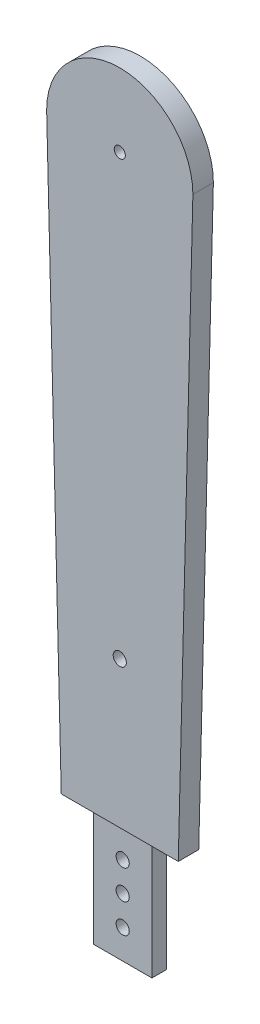
from build123d import *

# Parameters (mm, degrees)
BOSS_EXTRUDE3_DEPTH = 3.5
SKETCH18_R          = 2.25
CUT_EXTRUDE10_DEPTH = 14
SKETCH17_R          = 1.9
CUT_EXTRUDE13_DEPTH = 24
SKETCH14_W          = 20
SKETCH14_H          = 5
BOSS_EXTRUDE4_DEPTH = 40
SKETCH23_R          = 2.25
CUT_EXTRUDE15_DEPTH = 7


with BuildPart() as part:
    # Sketch7 → Boss-Extrude3 (new, symmetric)
    with BuildSketch(Plane.XY):
        with BuildLine():
            ThreePointArc((25, 0), (0, 25), (-25, 0))
            Line((-25, 0), (-20, -200))
            Line((-20, -200), (20, -200))
            Line((20, -200), (25, 0))
        make_face()
    extrude(amount=BOSS_EXTRUDE3_DEPTH, both=True)

    # Sketch18 → Cut-Extrude10 (cut)
    with BuildSketch(Plane.XY.offset(3.5)):
        with Locations((0, -150)):
            Circle(SKETCH18_R)
    extrude(amount=-CUT_EXTRUDE10_DEPTH, mode=Mode.SUBTRACT)

    # Sketch17 → Cut-Extrude13 (cut, symmetric)
    with BuildSketch(Plane.XY.offset(3.5)):
        Circle(SKETCH17_R)
    extrude(amount=CUT_EXTRUDE13_DEPTH, both=True, mode=Mode.SUBTRACT)

    # Sketch14 → Boss-Extrude4 (add)
    with BuildSketch(Plane.XZ.offset(200)):
        Rectangle(SKETCH14_W, SKETCH14_H)
    extrude(amount=BOSS_EXTRUDE4_DEPTH)

    # Sketch23 → Cut-Extrude15 (cut)
    with BuildSketch(Plane.XY.offset(3.5)):
        with Locations((0, -210)):
            Circle(SKETCH23_R)
        with Locations((0, -230)):
            Circle(SKETCH23_R)
        with Locations((0, -220)):
            Circle(SKETCH23_R)
    extrude(amount=-CUT_EXTRUDE15_DEPTH, mode=Mode.SUBTRACT)


solid = part.part
